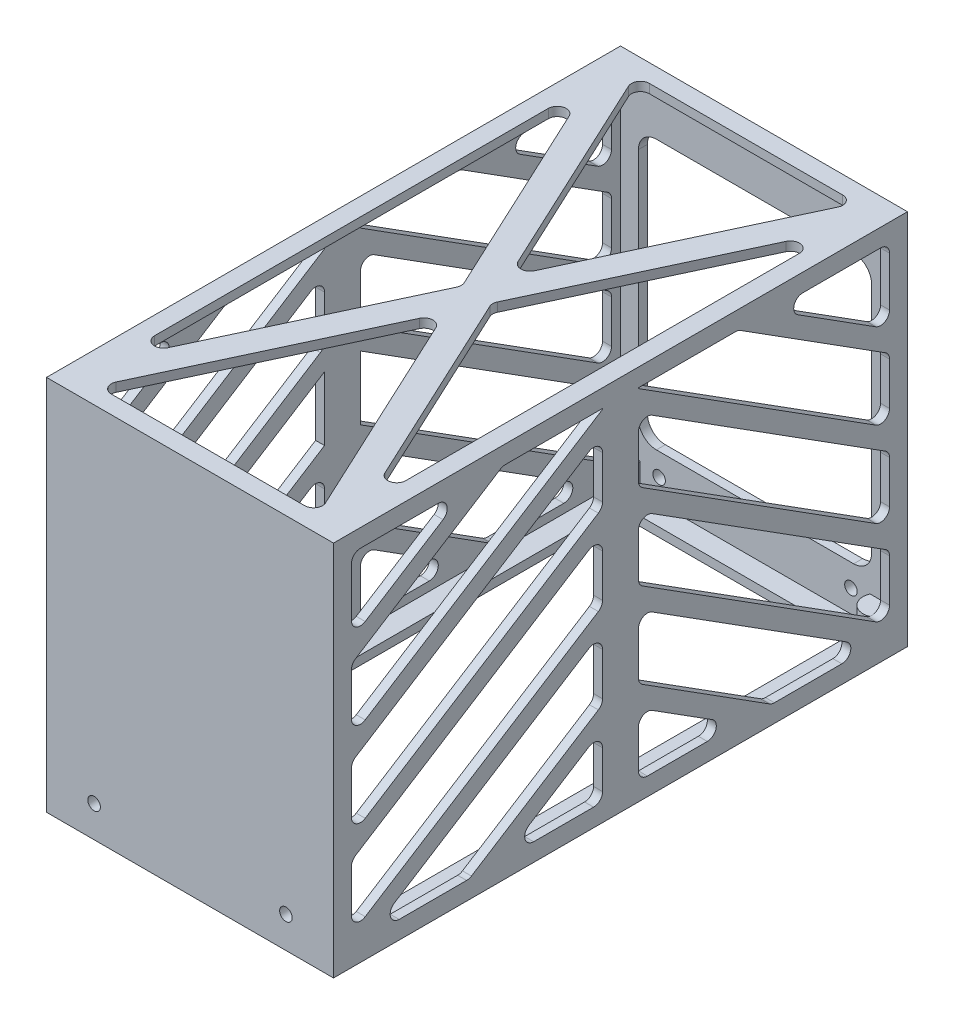
from build123d import *

# Parameters (mm, degrees)
SKETCH2_W               = 101.6
SKETCH2_H               = 203.2
BOSS_EXTRUDE1_DEPTH     = 133.35
SKETCH3_R               = 2.0701
CUT_EXTRUDE1_DEPTH      = 9.525
SHELL1_START            = 3.175
SHELL1_DEPTH            = 127
SHELL1_START_2          = 12.7
SHELL1_2_DEPTH          = 117.475
CUT_EXTRUDE2_DEPTH      = 3.175
SKETCH5_R               = 2.2225
CUT_EXTRUDE3_DEPTH      = 3.175
SKETCH6_W               = 82.55
SKETCH6_H               = 95.25
CUT_EXTRUDE4_DEPTH      = 3.175
MIRROR2_COPY_1_SKETCH_R = 2.2225
MIRROR2_COPY_1_DEPTH    = 3.175
CUT_EXTRUDE5_DEPTH      = 3.175
FILLET1_R               = 3.175
FILLET2_R               = 3.175
FILLET3_R               = 6.35
CUT_EXTRUDE6_DEPTH      = 3.175
FILLET4_R               = 3.175


# Read off the part's stored shape, not the designer's step: Shell1
with BuildPart() as part:
    # Sketch2 → Boss-Extrude1 (new body)
    with BuildSketch(Plane(origin=(0, 0, 0), x_dir=(1, 0, 0), z_dir=(0, 1, 0))):
        Rectangle(SKETCH2_W, SKETCH2_H)
    extrude(amount=BOSS_EXTRUDE1_DEPTH)

    # Sketch3 → Cut-Extrude1 (cut)
    with BuildSketch(Plane.XZ):
        with Locations(Location((45.5549, -96.3549, 0), (0, 0, 270))):
            Circle(SKETCH3_R)
        with Locations(Location((-45.5549, -96.3549, 0), (0, 0, 270))):
            Circle(SKETCH3_R)
        with Locations(Location((45.5549, 96.3549, 0), (0, 0, 270))):
            Circle(SKETCH3_R)
        with Locations(Location((-45.5549, 96.3549, 0), (0, 0, 270))):
            Circle(SKETCH3_R)
    extrude(amount=-CUT_EXTRUDE1_DEPTH, mode=Mode.SUBTRACT)

    # Shell1 outline → Shell1 (cut)
    with BuildSketch(Plane(origin=(0, 0, 0), x_dir=(1, 0, 0), z_dir=(0, 1, 0)).offset(SHELL1_START)):
        with BuildLine():
            Line((-47.625, 91.535588846), (-47.625, -91.535588846))
            ThreePointArc((-47.625, -91.535588846), (-41.846054222, -92.646054222), (-40.735588846, -98.425))
            Line((-40.735588846, -98.425), (40.735588846, -98.425))
            ThreePointArc((40.735588846, -98.425), (41.846054222, -92.646054222), (47.625, -91.535588846))
            Line((47.625, -91.535588846), (47.625, 91.535588846))
            ThreePointArc((47.625, 91.535588846), (41.846054222, 92.646054222), (40.735588846, 98.425))
            Line((40.735588846, 98.425), (-40.735588846, 98.425))
            ThreePointArc((-40.735588846, 98.425), (-41.846054222, 92.646054222), (-47.625, 91.535588846))
        make_face()
    extrude(amount=SHELL1_DEPTH, mode=Mode.SUBTRACT)

    # Shell1 2 outline → Shell1 2 (cut)
    with BuildSketch(Plane(origin=(0, 0, 0), x_dir=(1, 0, 0), z_dir=(0, 1, 0)).offset(SHELL1_START_2)):
        with BuildLine():
            Line((-47.625, -91.535588846), (-47.625, -98.425))
            Line((-47.625, -98.425), (-40.735588846, -98.425))
            ThreePointArc((-40.735588846, -98.425), (-41.846054222, -92.646054222), (-47.625, -91.535588846))
        make_face()
        with BuildLine():
            Line((-47.625, 98.425), (-47.625, 91.535588846))
            ThreePointArc((-47.625, 91.535588846), (-41.846054222, 92.646054222), (-40.735588846, 98.425))
            Line((-40.735588846, 98.425), (-47.625, 98.425))
        make_face()
        with BuildLine():
            ThreePointArc((47.625, -91.535588846), (41.846054222, -92.646054222), (40.735588846, -98.425))
            Line((40.735588846, -98.425), (47.625, -98.425))
            Line((47.625, -98.425), (47.625, -91.535588846))
        make_face()
        with BuildLine():
            Line((47.625, 98.425), (40.735588846, 98.425))
            ThreePointArc((40.735588846, 98.425), (41.846054222, 92.646054222), (47.625, 91.535588846))
            Line((47.625, 91.535588846), (47.625, 98.425))
        make_face()
    extrude(amount=SHELL1_2_DEPTH, mode=Mode.SUBTRACT)

    # Sketch4 → Cut-Extrude2 (cut)
    with BuildSketch(Plane.XZ):
        with BuildLine():
            ThreePointArc((-37.1348, -91.1098), (-39.37986403, -90.17986403), (-40.3098, -87.9348))
            Line((-40.3098, -87.9348), (-40.3098, 87.9348))
            ThreePointArc((-40.3098, 87.9348), (-39.37986403, 90.17986403), (-37.1348, 91.1098))
            Line((-37.1348, 91.1098), (37.1348, 91.1098))
            ThreePointArc((37.1348, 91.1098), (39.37986403, 90.17986403), (40.3098, 87.9348))
            Line((40.3098, 87.9348), (40.3098, -87.9348))
            ThreePointArc((40.3098, -87.9348), (39.37986403, -90.17986403), (37.1348, -91.1098))
            Line((37.1348, -91.1098), (-37.1348, -91.1098))
        make_face()
    extrude(amount=-CUT_EXTRUDE2_DEPTH, mode=Mode.SUBTRACT)

    # Sketch5 → Cut-Extrude3 (cut)
    with BuildSketch(Plane(origin=(0, 0, -101.6), x_dir=(-1, 0, 0), z_dir=(0, 0, -1))):
        with Locations((33.9598, 11.1125)):
            Circle(SKETCH5_R)
    cut_extrude3 = extrude(amount=-CUT_EXTRUDE3_DEPTH, mode=Mode.SUBTRACT)

    # Mirror1: Cut-Extrude3 across plane
    add(cut_extrude3.mirror(Plane.XY), mode=Mode.SUBTRACT)

    # Sketch6 → Cut-Extrude4 (cut)
    with BuildSketch(Plane(origin=(0, 0, -101.6), x_dir=(-1, 0, 0), z_dir=(0, 0, -1))):
        with Locations((0, 66.675)):
            Rectangle(SKETCH6_W, SKETCH6_H)
    extrude(amount=-CUT_EXTRUDE4_DEPTH, mode=Mode.SUBTRACT)

    # Mirror2: Cut-Extrude3 across plane
    add(cut_extrude3.mirror(Plane(origin=(0, 0, 0), x_dir=(0, 0, 1), z_dir=(1, 0, 0))), mode=Mode.SUBTRACT)

    # Mirror2 copy 1 sketch → Mirror2 copy 1 (cut)
    with BuildSketch(Plane.XY.offset(101.6)):
        with Locations((33.9598, 11.1125)):
            Circle(MIRROR2_COPY_1_SKETCH_R)
    extrude(amount=-MIRROR2_COPY_1_DEPTH, mode=Mode.SUBTRACT)

    # Sketch7 → Cut-Extrude5 (cut)
    with BuildSketch(Plane.ZY.offset(50.8)):
        Polygon((-41.690998224, 127), (-95.25, 93.079298875), (-95.25, 70.433201125), (-6.35, 126.736534458), (-6.35, 127), align=None)
        Polygon((-53.559001776, 127), (-95.25, 127), (-95.25, 100.595701125), align=None)
        Polygon((-6.35, 119.220132209), (-95.25, 62.916798875), (-95.25, 40.270701125), (-6.35, 96.574034458), align=None)
        Polygon((-6.35, 89.057632208), (-95.25, 32.754298875), (-95.25, 10.108201125), (-6.35, 66.411534458), align=None)
        Polygon((-6.35, 58.895132209), (-89.315998224, 6.35), (-53.559001776, 6.35), (-6.35, 36.249034458), align=None)
        Polygon((-6.35, 28.732632209), (-41.690998224, 6.35), (-6.35, 6.35), align=None)
        Polygon((41.690998224, 6.35), (6.35, 28.732632209), (6.35, 6.35), align=None)
        Polygon((89.315998224, 6.35), (6.35, 58.895132209), (6.35, 36.249034458), (53.559001776, 6.35), align=None)
        Polygon((95.25, 32.754298875), (6.35, 89.057632208), (6.35, 66.411534458), (95.25, 10.108201125), align=None)
        Polygon((95.25, 62.916798875), (6.35, 119.220132209), (6.35, 96.574034458), (95.25, 40.270701125), align=None)
        Polygon((41.690998224, 127), (6.35, 127), (6.35, 126.736534458), (95.25, 70.433201125), (95.25, 93.079298875), align=None)
        Polygon((95.25, 127), (53.559001776, 127), (95.25, 100.595701125), align=None)
    cut_extrude5 = extrude(amount=-CUT_EXTRUDE5_DEPTH, mode=Mode.SUBTRACT)

    # Mirror3: Cut-Extrude5 across plane
    add(cut_extrude5.mirror(Plane(origin=(0, 0, 0), x_dir=(0, 0, 1), z_dir=(1, 0, 0))), mode=Mode.SUBTRACT)

    # Fillet1
    # the kernel refuses this fillet: 3.175 mm, written as the material it adds along each edge
    with BuildSketch(Plane(origin=(50.8, 93.079298875, -95.25), x_dir=(0, 0.5350520811843479, 0.8448190755542266), z_dir=(-1, 0, 0)), Plane(origin=(50.8, 32.754298875, -95.25), x_dir=(0, 0.535052081183464, 0.8448190755547864), z_dir=(-1, 0, 0)), Plane(origin=(50.8, 66.411534458, -6.35), x_dir=(0, -0.5350520811848797, -0.8448190755538897), z_dir=(-1, 0, 0)), Plane(origin=(50.8, 62.916798875, -95.25), x_dir=(0, 0.535052081184653, 0.8448190755540333), z_dir=(-1, 0, 0)), Plane(origin=(50.8, 62.916798875, 95.25), x_dir=(0, -1, 0), z_dir=(-1, 0, 0)), Plane(origin=(50.8, 93.079298875, 95.25), x_dir=(0, -1, 0), z_dir=(-1, 0, 0)), Plane(origin=(50.8, 32.754298875, 95.25), x_dir=(0, -1, 0), z_dir=(-1, 0, 0)), Plane(origin=(50.8, 66.411534458, 6.35), x_dir=(0, 1, 0), z_dir=(-1, 0, 0))) as fillet1_piece_1:
        with BuildLine():
            CenterArc((FILLET1_R * 0.550352060304, -FILLET1_R), FILLET1_R, 90, 57.652556501)
            Line((-FILLET1_R * 0.29446701525, -FILLET1_R * 0.464947918816), (0, 0))
            Line((0, 0), (FILLET1_R * 0.550352060304, 0))
        make_face()
    extrude(amount=3.175)
    with BuildSketch(Plane(origin=(50.8, 70.433201125, -95.25), x_dir=(0, 1, 0), z_dir=(-1, 0, 0)), Plane(origin=(50.8, 10.108201125, -95.25), x_dir=(0, 1, 0), z_dir=(-1, 0, 0)), Plane(origin=(50.8, 58.895132209, -6.35), x_dir=(0, -1, 0), z_dir=(-1, 0, 0)), Plane(origin=(50.8, 100.595701125, -95.25), x_dir=(0, 1, 0), z_dir=(-1, 0, 0)), Plane(origin=(50.8, 40.270701125, -95.25), x_dir=(0, 1, 0), z_dir=(-1, 0, 0)), Plane(origin=(50.8, 119.220132209, -6.35), x_dir=(0, -1, 0), z_dir=(-1, 0, 0)), Plane(origin=(50.8, 40.270701125, 95.25), x_dir=(0, 0.535052081183713, -0.8448190755546287), z_dir=(-1, 0, 0)), Plane(origin=(50.8, 119.220132209, 6.35), x_dir=(0, -0.5350520811846956, 0.8448190755540064), z_dir=(-1, 0, 0)), Plane(origin=(50.8, 100.595701125, 95.25), x_dir=(0, 0.5350520811843453, -0.8448190755542281), z_dir=(-1, 0, 0)), Plane(origin=(50.8, 70.433201125, 95.25), x_dir=(0, 0.5350520811838205, -0.8448190755545606), z_dir=(-1, 0, 0)), Plane(origin=(50.8, 28.732632209, 6.35), x_dir=(0, -0.5350520811831904, 0.8448190755549597), z_dir=(-1, 0, 0)), Plane(origin=(50.8, 10.108201125, 95.25), x_dir=(0, 0.5350520811844391, -0.8448190755541688), z_dir=(-1, 0, 0)), Plane(origin=(50.8, 58.895132209, 6.35), x_dir=(0, -0.5350520811845683, 0.8448190755540871), z_dir=(-1, 0, 0))) as fillet1_piece_2:
        with BuildLine():
            CenterArc((FILLET1_R * 1.81701872697, -FILLET1_R), FILLET1_R, 90, 122.347443499)
            Line((FILLET1_R * 0.972199651415, -FILLET1_R * 1.53505208118), (0, 0))
            Line((0, 0), (FILLET1_R * 1.81701872697, 0))
        make_face()
    extrude(amount=3.175)
    with BuildSketch(Plane(origin=(50.8, 127, -41.690998224), x_dir=(0, 0, 1), z_dir=(-1, 0, 0)), Plane(origin=(50.8, 6.35, -53.559001776), x_dir=(0, 0, -1), z_dir=(-1, 0, 0)), Plane(origin=(50.8, 127, 41.690998224), x_dir=(0, -0.5350520811843464, 0.8448190755542275), z_dir=(-1, 0, 0)), Plane(origin=(50.8, 6.35, 53.559001776), x_dir=(0, 0.5350520811848904, -0.8448190755538829), z_dir=(-1, 0, 0))) as fillet1_piece_3:
        with BuildLine():
            CenterArc((FILLET1_R * 0.290029568902, -FILLET1_R), FILLET1_R, 90, 32.347443499)
            Line((-FILLET1_R * 0.245022512283, -FILLET1_R * 0.155180924446), (0, 0))
            Line((0, 0), (FILLET1_R * 0.290029568902, 0))
        make_face()
    extrude(amount=3.175)
    with BuildSketch(Plane(origin=(50.8, 89.057632208, -6.35), x_dir=(0, -0.5350520811829528, -0.8448190755551102), z_dir=(-1, 0, 0)), Plane(origin=(50.8, 28.732632209, -6.35), x_dir=(0, -0.5350520811831901, -0.8448190755549598), z_dir=(-1, 0, 0)), Plane(origin=(50.8, 89.057632208, 6.35), x_dir=(0, -1.0, -1.1288066002221462e-12), z_dir=(-1, 0, 0))) as fillet1_piece_4:
        with BuildLine():
            CenterArc((FILLET1_R * 1.81701872697, FILLET1_R), FILLET1_R, 147.652556501, 122.347443499)
            Line((FILLET1_R * 0.972199651414, FILLET1_R * 1.53505208118), (0, 0))
            Line((0, 0), (FILLET1_R * 1.81701872697, 0))
        make_face()
    extrude(amount=3.175)
    with BuildSketch(Plane(origin=(50.8, 6.35, -41.690998224), x_dir=(0, 0.5350520811837003, 0.8448190755546368), z_dir=(-1, 0, 0)), Plane(origin=(50.8, 6.35, -89.315998224), x_dir=(0, 0.5350520811845216, 0.8448190755541165), z_dir=(-1, 0, 0)), Plane(origin=(50.8, 127, 53.559001776), x_dir=(0, 0, 1), z_dir=(-1, 0, 0)), Plane(origin=(50.8, 6.35, 89.315998224), x_dir=(0, 0, -1), z_dir=(-1, 0, 0))) as fillet1_piece_5:
        with BuildLine():
            CenterArc((FILLET1_R * 3.44792430575, -FILLET1_R), FILLET1_R, 90, 147.652556501)
            Line((FILLET1_R * 2.91287222456, -FILLET1_R * 1.84481907555), (0, 0))
            Line((0, 0), (FILLET1_R * 3.44792430575, 0))
        make_face()
    extrude(amount=3.175)
    with BuildSketch(Plane(origin=(50.8, 6.35, -6.35), x_dir=(0, 0, -1), z_dir=(-1, 0, 0)), Plane(origin=(50.8, 127, -95.25), x_dir=(0, 0, 1), z_dir=(-1, 0, 0)), Plane(origin=(50.8, 6.35, 6.35), x_dir=(0, 1, 0), z_dir=(-1, 0, 0))) as fillet1_piece_6:
        with BuildLine():
            CenterArc((FILLET1_R, -FILLET1_R), FILLET1_R, 90, 90)
            Line((0, -FILLET1_R), (0, 0))
            Line((0, 0), (FILLET1_R, 0))
        make_face()
    extrude(amount=3.175)
    with BuildSketch(Plane(origin=(50.8, 36.249034458, -6.35), x_dir=(0, 1, 0), z_dir=(-1, 0, 0)), Plane(origin=(50.8, 96.574034458, -6.35), x_dir=(0, 1.0, -4.404885006320855e-12), z_dir=(-1, 0, 0)), Plane(origin=(50.8, 96.574034458, 6.35), x_dir=(0, -0.5350520811857066, 0.8448190755533662), z_dir=(-1, 0, 0)), Plane(origin=(50.8, 36.249034458, 6.35), x_dir=(0, -0.535052081185041, 0.8448190755537875), z_dir=(-1, 0, 0))) as fillet1_piece_7:
        with BuildLine():
            CenterArc((FILLET1_R * 0.550352060304, FILLET1_R), FILLET1_R, 212.347443499, 57.652556501)
            Line((-FILLET1_R * 0.29446701525, FILLET1_R * 0.464947918815), (0, 0))
            Line((0, 0), (FILLET1_R * 0.550352060304, 0))
        make_face()
    extrude(amount=3.175)
    with BuildSketch(Plane(origin=(50.8, 127, -53.559001776), x_dir=(0, 0, -1), z_dir=(-1, 0, 0)), Plane(origin=(50.8, 6.35, 41.690998224), x_dir=(0, 0.5350520811837004, -0.8448190755546366), z_dir=(-1, 0, 0))) as fillet1_piece_8:
        with BuildLine():
            CenterArc((FILLET1_R * 3.44792430574, FILLET1_R), FILLET1_R, 122.347443499, 147.652556501)
            Line((FILLET1_R * 2.91287222456, FILLET1_R * 1.84481907555), (0, 0))
            Line((0, 0), (FILLET1_R * 3.44792430574, 0))
        make_face()
    extrude(amount=3.175)
    with BuildSketch(Plane(origin=(50.8, 127, 95.25), x_dir=(0, 0, -1), z_dir=(-1, 0, 0))) as fillet1_piece_9:
        with BuildLine():
            CenterArc((FILLET1_R, FILLET1_R), FILLET1_R, 180, 90)
            Line((0, FILLET1_R), (0, 0))
            Line((0, 0), (FILLET1_R, 0))
        make_face()
    extrude(amount=3.175)

    # Fillet2
    fillet2_edges = [part.edges().sort_by_distance(p)[0] for p in [
        (-49.2125, 70.433201125, -95.25),
        (-49.2125, 93.079298875, -95.25),
        (-49.2125, 127, -41.690998224),
        (-49.2125, 6.35, -41.690998224),
        (-49.2125, 28.732632209, -6.35),
        (-49.2125, 6.35, -6.35),
        (-49.2125, 6.35, -53.559001776),
        (-49.2125, 6.35, -89.315998224),
        (-49.2125, 58.895132209, -6.35),
        (-49.2125, 36.249034458, -6.35),
        (-49.2125, 127, -53.559001776),
        (-49.2125, 100.595701125, -95.25),
        (-49.2125, 127, -95.25),
        (-49.2125, 40.270701125, -95.25),
        (-49.2125, 62.916798875, -95.25),
        (-49.2125, 119.220132209, -6.35),
        (-49.2125, 96.574034458, -6.35),
        (-49.2125, 62.916798875, 95.25),
        (-49.2125, 40.270701125, 95.25),
        (-49.2125, 96.574034458, 6.35),
        (-49.2125, 119.220132209, 6.35),
        (-49.2125, 127, 53.559001776),
        (-49.2125, 127, 95.25),
        (-49.2125, 100.595701125, 95.25),
        (-49.2125, 127, 41.690998224),
        (-49.2125, 93.079298875, 95.25),
        (-49.2125, 70.433201125, 95.25),
        (-49.2125, 6.35, 41.690998224),
        (-49.2125, 6.35, 6.35),
        (-49.2125, 28.732632209, 6.35),
        (-49.2125, 6.35, 89.315998224),
        (-49.2125, 6.35, 53.559001776),
        (-49.2125, 36.249034458, 6.35),
        (-49.2125, 58.895132209, 6.35),
    ]]
    fillet(fillet2_edges, radius=FILLET2_R)

    # Fillet3
    fillet3_edges = [part.edges().sort_by_distance(p)[0] for p in [
        (41.275, 19.05, -100.0125),
        (41.275, 114.3, -100.0125),
        (-41.275, 114.3, -100.0125),
        (-41.275, 19.05, -100.0125),
    ]]
    fillet(fillet3_edges, radius=FILLET3_R)

    # Sketch8 → Cut-Extrude6 (cut)
    with BuildSketch(Plane(origin=(0, 133.35, 0), x_dir=(1, 0, 0), z_dir=(0, 1, 0))):
        Polygon((5.255560151, 0), (44.45, -83.988085391), (44.45, 83.988085391), align=None)
        Polygon((-39.194439849, 95.25), (0, 11.261914609), (39.194439849, 95.25), align=None)
        Polygon((-44.45, -83.988085391), (-5.255560151, 0), (-44.45, 83.988085391), align=None)
        Polygon((-39.194439849, -95.25), (39.194439849, -95.25), (0, -11.261914609), align=None)
    extrude(amount=-CUT_EXTRUDE6_DEPTH, mode=Mode.SUBTRACT)

    # Fillet4
    fillet4_edges = [part.edges().sort_by_distance(p)[0] for p in [
        (44.45, 131.7625, 83.988085391),
        (5.255560151, 131.7625, 0),
        (44.45, 131.7625, -83.988085391),
        (-5.255560151, 131.7625, 0),
        (-44.45, 131.7625, 83.988085391),
        (-44.45, 131.7625, -83.988085391),
        (39.194439849, 131.7625, 95.25),
        (-39.194439849, 131.7625, 95.25),
        (0, 131.7625, 11.261914609),
        (0, 131.7625, -11.261914609),
        (-39.194439849, 131.7625, -95.25),
        (39.194439849, 131.7625, -95.25),
    ]]
    fillet(fillet4_edges, radius=FILLET4_R)


solid = part.part
